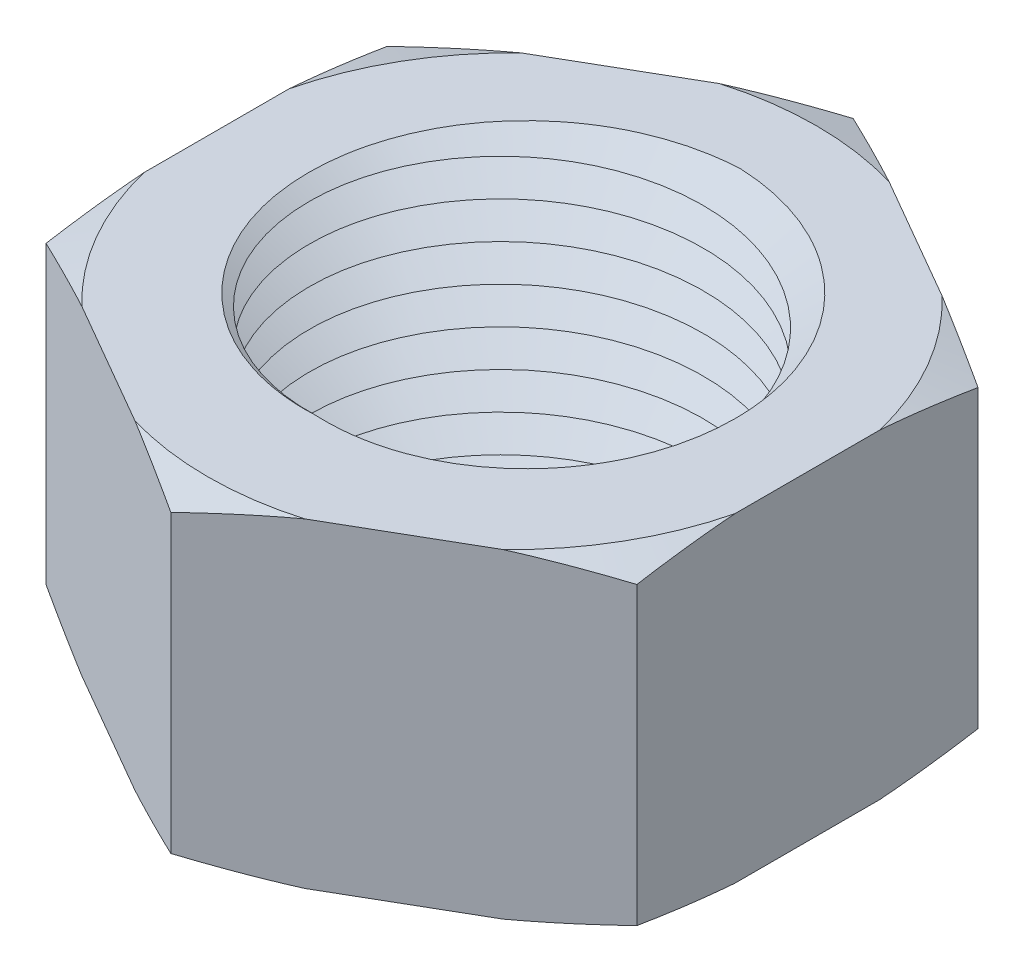
from build123d import *

# Parameters (mm, degrees)
SKETCH_1_R      = 8
EXTRUDE_1_DEPTH = 6.5
SWEEP_5_PITCH   = 1.5


with BuildPart() as part:
    # 草图1 → 凸台-拉伸1 (new, symmetric)
    with BuildSketch(Plane(origin=(0, 0, 0), x_dir=(1, 0, 0), z_dir=(0, 1, 0))):
        Polygon((0, 13.856406461), (-12, 6.92820323), (-12, -6.92820323), (0, -13.856406461), (12, -6.92820323), (12, 6.92820323), align=None)
        with Locations(Location((0, 0, 0), (0, 0, 90))):
            Circle(SKETCH_1_R, mode=Mode.SUBTRACT)
    extrude(amount=EXTRUDE_1_DEPTH, both=True)

    # 草图2 → 切除-旋转1 (revolve, cut)
    with BuildSketch(Plane(origin=(0, 0, 0), x_dir=(0.8660254037844416, 0, 0.499999999999995), z_dir=(-0.49999999999999495, 0, 0.8660254037844415))):
        Polygon((12.356406461, 6.5), (13.856406461, 6.5), (13.856406461, 6), align=None)
        Polygon((13.856406461, -6), (12.356406461, -6.5), (13.856406461, -6.5), align=None)
    revolve(axis=Axis((0, 0, 0), (0, 1, 0)), mode=Mode.SUBTRACT)

    # 切除-扫描5: arcs per turn and ends read off the stored shape
    # 切除-扫描5: the profile of 草图5 profile screwed along a right-hand helix through 11 turns, 8 arcs to a turn; built about Z, then put on its axis
    sweep_5_z = Axis((0, 0, 0), (0, 0, 1))
    sweep_5_corners = [(7.9997, 0, -2.250673205), (7.9997, 0, -0.749326795), (9.299904131, 0, -1.5)]
    with BuildLine(mode=Mode.PRIVATE) as sweep_5_profile:
        Line(sweep_5_corners[0], sweep_5_corners[1])
        Line(sweep_5_corners[1], sweep_5_corners[2])
        Line(sweep_5_corners[2], sweep_5_corners[0])
    sweep_5_cap = Face(sweep_5_profile.wire())
    sweep_5_turn_angles = [0, 22.5, 45, 67.5, 90, 112.5, 135, 157.5, 180, 202.5, 225, 247.5, 270, 292.5, 315, 337.5, 360]
    sweep_5_turn_weights = [1, 0.9238795325112867, 1, 0.9238795325112867, 1, 0.9238795325112867, 1, 0.9238795325112867, 1, 0.9238795325112867, 1, 0.9238795325112867, 1, 0.9238795325112867, 1, 0.9238795325112867, 1]
    sweep_5_turn_rails = [Edge.make_bspline([Vector(p[0], p[1], 0).rotate(sweep_5_z, sweep_5_turn_angles[k]) / sweep_5_turn_weights[k] + Vector(0, 0, p[2] + SWEEP_5_PITCH * sweep_5_turn_angles[k] / 360) for k in range(17)], [0, 0, 0, 1, 1, 2, 2, 3, 3, 4, 4, 5, 5, 6, 6, 7, 7, 8, 8, 8], 2, sweep_5_turn_weights) for p in sweep_5_corners]
    sweep_5_turn_sides = [Face.make_surface_from_curves(sweep_5_turn_rails[p[0]], sweep_5_turn_rails[p[1]]) for p in [(0, 1), (1, 2), (2, 0)]]
    sweep_5_turn = Solid(Shell([*sweep_5_turn_sides, sweep_5_cap, sweep_5_cap.rotate(sweep_5_z, 360).moved(Location((0, 0, SWEEP_5_PITCH * 360 / 360)))]))
    sweep_5_each = [*[sweep_5_turn.moved(Location((0, 0, SWEEP_5_PITCH * i))) for i in range(11)]]
    add(Plane(origin=(0, 6.5, 0), x_dir=(0, 0, -1), z_dir=(0, -1, 0)) * Compound([sweep_5_each[i] for i in range(0, 11, 2)]), mode=Mode.SUBTRACT)
    add(Plane(origin=(0, 6.5, 0), x_dir=(0, 0, -1), z_dir=(0, -1, 0)) * Compound([sweep_5_each[i] for i in range(1, 11, 2)]), mode=Mode.SUBTRACT)


solid = part.part
